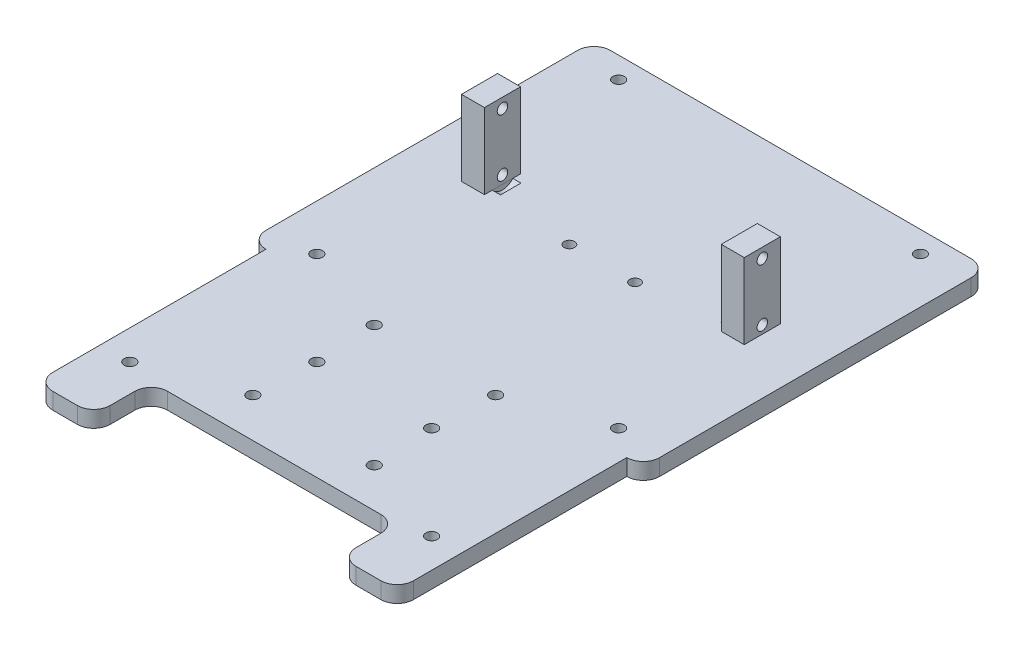
from build123d import *

# Parameters (mm, degrees)
EXTRUDE_1_DEPTH             = 5
SKETCH_2_W                  = 7
SKETCH_2_H                  = 11
EXTRUDE_2_DEPTH             = 23
SKETCH_3_R                  = 1.6
CUT_EXTRUDE_1_DEPTH         = 159.19437411
SKETCH_5_R                  = 1.75
CUT_EXTRUDE_1416_DEPTH      = 139.330220849
SKETCH2_R                   = 4
CUT_EXTRUDE1_DEPTH          = 2.5
CUT_EXTRUDE2_START          = 2.5
SKETCH3_R                   = 4
CUT_EXTRUDE2_DEPTH          = 2.5
CUT_EXTRUDE_2297_DEPTH      = 139.330220849
CUT_EXTRUDE_2297_DEPTH_BACK = 139.330220849
SKETCH4_R                   = 1.6
SKETCH6_R                   = 1.75
CUT_EXTRUDE_2671_DEPTH      = 139.330220849
SKETCH7_R                   = 1.75
CUT_EXTRUDE_3080_DEPTH      = 139.330220849
SKETCH9_R                   = 1.75
CUT_EXTRUDE_3618_DEPTH      = 139.330220849
SKETCH8_W                   = 75
SKETCH8_H                   = 35
CUT_EXTRUDE7_DEPTH          = 139.330220849
FILLET_1_R                  = 5
FILLET2_R                   = 5


with BuildPart() as part:
    # 스케치1 → 보스-돌출1 (new body)
    with BuildSketch(Plane(origin=(0, 0, 0), x_dir=(1, 0, 0), z_dir=(0, 1, 0))):
        Polygon((-55, -52.5), (-60, -52.5), (-60, 52.5), (60, 52.5), (60, -52.5), (55, -52.5), (55, -122.5), (-55, -122.5), align=None)
    extrude(amount=EXTRUDE_1_DEPTH)

    # 스케치5 → Cut-Extrude 1416 (cut, through all)
    with BuildSketch(Plane(origin=(0, 5, 0), x_dir=(1, 0, 0), z_dir=(0, 1, 0))):
        with Locations(Location((-46, -46, 0), (0, 0, 270))):
            Circle(SKETCH_5_R)
        with Locations(Location((-46, 46, 0), (0, 0, 270))):
            Circle(SKETCH_5_R)
        with Locations(Location((46, 46, 0), (0, 0, 270))):
            Circle(SKETCH_5_R)
        with Locations(Location((46, -46, 0), (0, 0, 270))):
            Circle(SKETCH_5_R)
    extrude(amount=-CUT_EXTRUDE_1416_DEPTH, mode=Mode.SUBTRACT)

    # Sketch2 → Cut-Extrude1 (cut)
    with BuildSketch(Plane.ZY.offset(-36.1)):
        with Locations((-0.7, 7.5)):
            Circle(SKETCH2_R)
    extrude(amount=CUT_EXTRUDE1_DEPTH, mode=Mode.SUBTRACT)

    # Sketch3 → Cut-Extrude2 (cut)
    with BuildSketch(Plane(origin=(-36.1, 0, 0), x_dir=(0, 0, -1), z_dir=(1, 0, 0)).offset(CUT_EXTRUDE2_START)):
        with Locations((0.7, 7.5)):
            Circle(SKETCH3_R)
    extrude(amount=-CUT_EXTRUDE2_DEPTH, mode=Mode.SUBTRACT)

    # Sketch4 → Cut-Extrude 2297 (cut, two sides: drawn at the far end of the back side and taken through both)
    with BuildSketch(Plane(origin=(0, 5, 0), x_dir=(1, 0, 0), z_dir=(0, 1, 0)).offset(-CUT_EXTRUDE_2297_DEPTH_BACK)):
        with Locations(Location((-10, -5, 0), (0, 0, 270))):
            Circle(SKETCH4_R)
        with Locations(Location((10, -5, 0), (0, 0, 270))):
            Circle(SKETCH4_R)
    extrude(amount=CUT_EXTRUDE_2297_DEPTH + CUT_EXTRUDE_2297_DEPTH_BACK, mode=Mode.SUBTRACT)

    # Sketch6 → Cut-Extrude 2671 (cut, through all)
    with BuildSketch(Plane(origin=(0, 5, 0), x_dir=(1, 0, 0), z_dir=(0, 1, 0))):
        with Locations(Location((-18.5, -93, 0), (0, 0, 270))):
            Circle(SKETCH6_R)
        with Locations(Location((-18.5, -56, 0), (0, 0, 270))):
            Circle(SKETCH6_R)
        with Locations(Location((18.5, -56, 0), (0, 0, 270))):
            Circle(SKETCH6_R)
        with Locations(Location((18.5, -93, 0), (0, 0, 270))):
            Circle(SKETCH6_R)
    extrude(amount=-CUT_EXTRUDE_2671_DEPTH, mode=Mode.SUBTRACT)

    # Sketch7 → Cut-Extrude 3080 (cut, through all)
    with BuildSketch(Plane(origin=(0, 5, 0), x_dir=(1, 0, 0), z_dir=(0, 1, 0))):
        with Locations(Location((-46, -103, 0), (0, 0, 270))):
            Circle(SKETCH7_R)
        with Locations(Location((46, -103, 0), (0, 0, 270))):
            Circle(SKETCH7_R)
    extrude(amount=-CUT_EXTRUDE_3080_DEPTH, mode=Mode.SUBTRACT)

    # Sketch9 → Cut-Extrude 3618 (cut, through all)
    with BuildSketch(Plane(origin=(0, 5, 0), x_dir=(1, 0, 0), z_dir=(0, 1, 0))):
        with Locations(Location((-17.5, -74.5, 0), (0, 0, 270))):
            Circle(SKETCH9_R)
        with Locations(Location((17.5, -74.5, 0), (0, 0, 270))):
            Circle(SKETCH9_R)
    extrude(amount=-CUT_EXTRUDE_3618_DEPTH, mode=Mode.SUBTRACT)

    # Sketch8 → Cut-Extrude7 (cut, through all)
    with BuildSketch(Plane(origin=(0, 5, 0), x_dir=(1, 0, 0), z_dir=(0, 1, 0))):
        with Locations((0, -122.5)):
            Rectangle(SKETCH8_W, SKETCH8_H)
    extrude(amount=-CUT_EXTRUDE7_DEPTH, mode=Mode.SUBTRACT)

    # 필렛1
    fillet_1_edges = [part.edges().sort_by_distance(p)[0] for p in [
        (37.5, 2.5, 122.5),
        (37.5, 2.5, 105),
        (-37.5, 2.5, 122.5),
        (-37.5, 2.5, 105),
        (-60, 2.5, -52.5),
        (60, 2.5, -52.5),
        (55, 2.5, 122.5),
        (-55, 2.5, 122.5),
    ]]
    fillet(fillet_1_edges, radius=FILLET_1_R)

    # Fillet2
    fillet2_edges = [part.edges().sort_by_distance(p)[0] for p in [
        (60, 2.5, 52.5),
        (-60, 2.5, 52.5),
    ]]
    fillet(fillet2_edges, radius=FILLET2_R - 0.0001)  # a hair under: the kernel refuses the full size


with BuildPart() as body_2:
    # 스케치2 → 보스-돌출2 (new body)
    with BuildSketch(Plane(origin=(0, 5, 0), x_dir=(1, 0, 0), z_dir=(0, 1, 0))):
        with Locations((-39.6, 0.7)):
            Rectangle(SKETCH_2_W, SKETCH_2_H)
    extrude(amount=EXTRUDE_2_DEPTH)

    # 스케치3 → 컷-돌출1 (cut, through all)
    with BuildSketch(Plane(origin=(-36.1, 0, 0), x_dir=(0, 0, -1), z_dir=(1, 0, 0))):
        with Locations((0.7, 25)):
            Circle(SKETCH_3_R)
        with Locations((0.7, 7.5)):
            Circle(SKETCH_3_R)
    extrude(amount=-CUT_EXTRUDE_1_DEPTH, mode=Mode.SUBTRACT)


with BuildPart() as body_3:
    # 대칭 복사1: mirrored copy
    add(body_2.part.mirror(Plane(origin=(0, 0, 0), x_dir=(0, 0, 1), z_dir=(1, 0, 0))))


solid = Compound([part.part, body_2.part, body_3.part])
